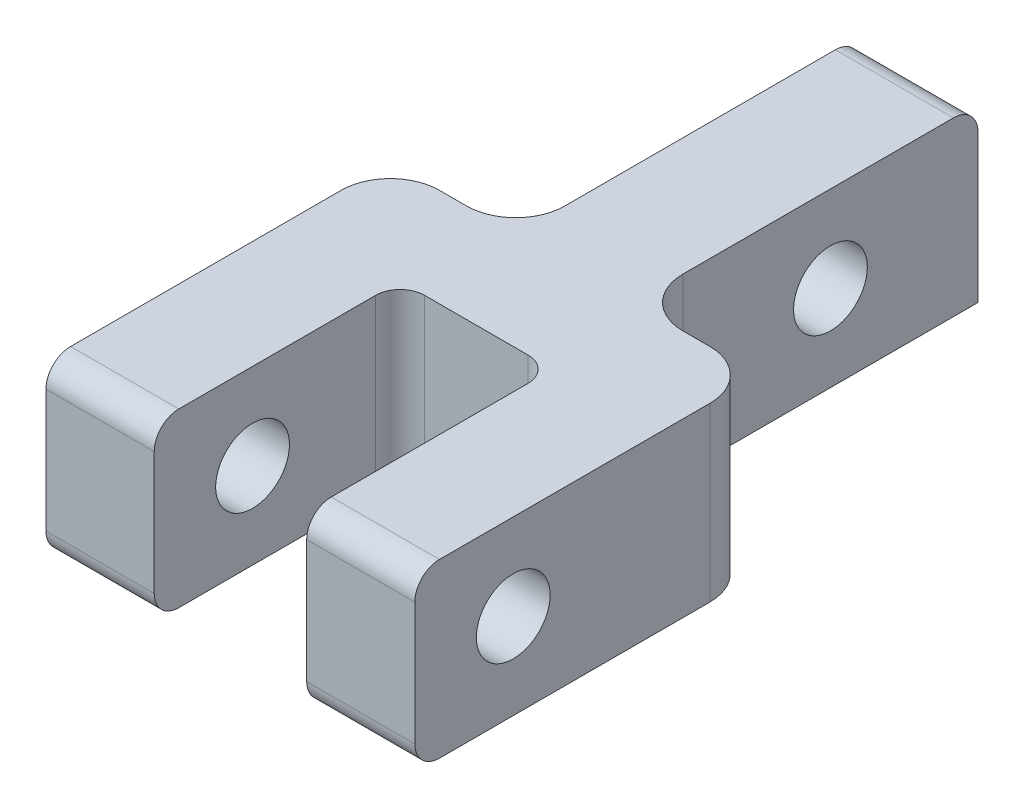
from build123d import *
from build123d.topology import SkipClean

# Parameters (mm, degrees)
SALIENTE_EXTRUIR1_DEPTH    = 2.4
CORTAR_EXTRUIR1_DEPTH      = 15.629080627
CORTAR_EXTRUIR1_DEPTH_BACK = 15.629080627
CROQUIS2_R                 = 1.5
CROQUIS3_R                 = 1.5
SALIENTE_EXTRUIR2_DEPTH    = 7.5
CORTAR_EXTRUIR2_DEPTH      = 3.1
REDONDEO1_R                = 2
REDONDEO2_R                = 1


with BuildPart() as part:
    # Croquis1 → Saliente-Extruir1 (new, symmetric)
    with BuildSketch(Plane(origin=(0, 0, 0), x_dir=(0, 0, -1), z_dir=(1, 0, 0))):
        with BuildLine():
            Line((-13, 3.5), (13, 3.5))
            ThreePointArc((13, 3.5), (13.707106781, 3.207106781), (14, 2.5))
            Line((14, 2.5), (14, -2.5))
            Line((14, -2.5), (14, -3.5))
            Line((14, -3.5), (13, -3.5))
            Line((13, -3.5), (-13, -3.5))
            ThreePointArc((-13, -3.5), (-13.707106781, -3.207106781), (-14, -2.5))
            Line((-14, -2.5), (-14, 2.5))
            ThreePointArc((-14, 2.5), (-13.707106781, 3.207106781), (-13, 3.5))
        make_face()
    extrude(amount=SALIENTE_EXTRUIR1_DEPTH, both=True)

    # Croquis2 → Cortar-Extruir1 (cut, two sides: drawn at the far end of the back side and taken through both)
    with BuildSketch(Plane(origin=(0, 0, 0), x_dir=(0, 0, -1), z_dir=(1, 0, 0)).offset(-CORTAR_EXTRUIR1_DEPTH_BACK)):
        with Locations((-10, 0)):
            Circle(CROQUIS2_R)
        with Locations((8, 0)):
            Circle(CROQUIS2_R)
    extrude(amount=CORTAR_EXTRUIR1_DEPTH + CORTAR_EXTRUIR1_DEPTH_BACK, mode=Mode.SUBTRACT)

    # Croquis3 → Saliente-Extruir2 (add, symmetric)
    with SkipClean():  # the faces are left unmerged after this step: merging them gives an invalid solid
        with BuildSketch(Plane(origin=(0, 0, 0), x_dir=(0, 0, -1), z_dir=(1, 0, 0))):
            with BuildLine():
                Line((-14, 2.5), (-14, -2.5))
                ThreePointArc((-14, -2.5), (-13.707106781, -3.207106781), (-13, -3.5))
                Line((-13, -3.5), (0, -3.5))
                Line((0, -3.5), (0, 3.5))
                Line((0, 3.5), (-13, 3.5))
                ThreePointArc((-13, 3.5), (-13.707106781, 3.207106781), (-14, 2.5))
            make_face()
            with Locations((-10, 0)):
                Circle(CROQUIS3_R, mode=Mode.SUBTRACT)
        extrude(amount=SALIENTE_EXTRUIR2_DEPTH, both=True)
    add(part.part.scale(1), mode=Mode.REPLACE)  # the faces are merged on a copy

    # Croquis4 → Cortar-Extruir2 (cut, symmetric)
    with BuildSketch(Plane(origin=(0, 0, 0), x_dir=(0, 0, -1), z_dir=(1, 0, 0))):
        with BuildLine():
            Line((-13, 3.5), (-4, 3.5))
            Line((-4, 3.5), (-4, -3.5))
            Line((-4, -3.5), (-13, -3.5))
            ThreePointArc((-13, -3.5), (-13.707106781, -3.207106781), (-14, -2.5))
            Line((-14, -2.5), (-14, 2.5))
            ThreePointArc((-14, 2.5), (-13.707106781, 3.207106781), (-13, 3.5))
        make_face()
    extrude(amount=CORTAR_EXTRUIR2_DEPTH, both=True, mode=Mode.SUBTRACT)

    # Redondeo1
    redondeo1_edges = [part.edges().sort_by_distance(p)[0] for p in [
        (2.4, 0, 0),
        (-2.4, 0, 0),
        (7.5, 0, 0),
        (-7.5, 0, 0),
    ]]
    fillet(redondeo1_edges, radius=REDONDEO1_R)

    # Redondeo2
    redondeo2_edges = [part.edges().sort_by_distance(p)[0] for p in [
        (3.1, 0, 4),
        (-3.1, 0, 4),
    ]]
    fillet(redondeo2_edges, radius=REDONDEO2_R)


solid = part.part
